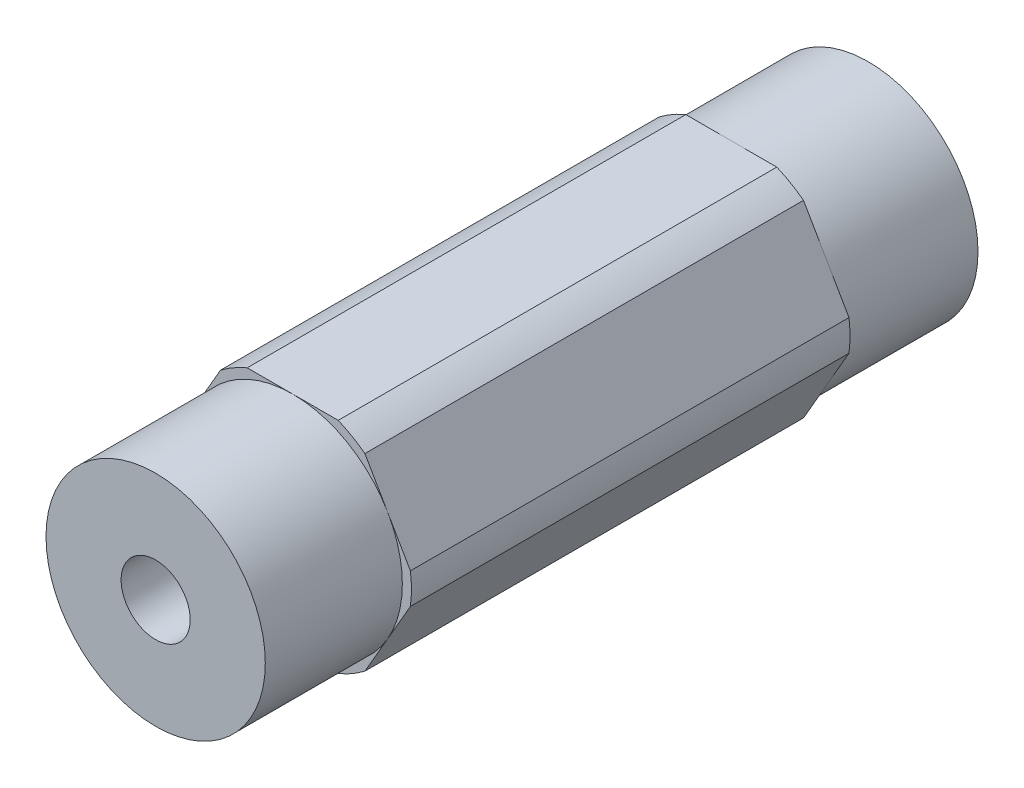
from build123d import *

# Parameters (mm, degrees)
SKETCH1_R           = 2.000000064
BOSS_EXTRUDE1_DEPTH = 12.7
SKETCH4_R           = 6.35
SKETCH4_R_2         = 2.000000064
BOSS_EXTRUDE2_DEPTH = 7.9375


with BuildPart() as part:
    # Sketch1 → Boss-Extrude1 (new, symmetric)
    with BuildSketch(Plane.XY):
        with BuildLine():
            ThreePointArc((4.181770846, 5.456960429), (3.437499983, 5.953924622), (2.634980936, 6.35))
            Line((2.634980936, 6.35), (-2.634980936, 6.35))
            ThreePointArc((-2.634980936, 6.35), (-3.437499983, 5.953924622), (-4.181770846, 5.456960429))
            Line((-4.181770846, 5.456960429), (-6.816751782, 0.893039571))
            ThreePointArc((-6.816751782, 0.893039571), (-6.874999966, 0), (-6.816751782, -0.893039571))
            Line((-6.816751782, -0.893039571), (-4.181770846, -5.456960429))
            ThreePointArc((-4.181770846, -5.456960429), (-3.437499983, -5.953924622), (-2.634980936, -6.35))
            Line((-2.634980936, -6.35), (2.634980936, -6.35))
            ThreePointArc((2.634980936, -6.35), (3.437499983, -5.953924622), (4.181770846, -5.456960429))
            Line((4.181770846, -5.456960429), (6.816751782, -0.893039571))
            ThreePointArc((6.816751782, -0.893039571), (6.860422465, -0.447468582), (6.874999966, 0))
            ThreePointArc((6.874999966, 0), (6.860422465, 0.447468582), (6.816751782, 0.893039571))
            Line((6.816751782, 0.893039571), (4.181770846, 5.456960429))
        make_face()
        Circle(SKETCH1_R, mode=Mode.SUBTRACT)
    extrude(amount=BOSS_EXTRUDE1_DEPTH, both=True)

    # Sketch4 → Boss-Extrude2 (add)
    with BuildSketch(Plane.XY.offset(12.7)):
        Circle(SKETCH4_R)
        Circle(SKETCH4_R_2, mode=Mode.SUBTRACT)
    boss_extrude2 = extrude(amount=BOSS_EXTRUDE2_DEPTH)

    # Mirror1: Boss-Extrude2 across plane
    add(boss_extrude2.mirror(Plane.XY))


solid = part.part
